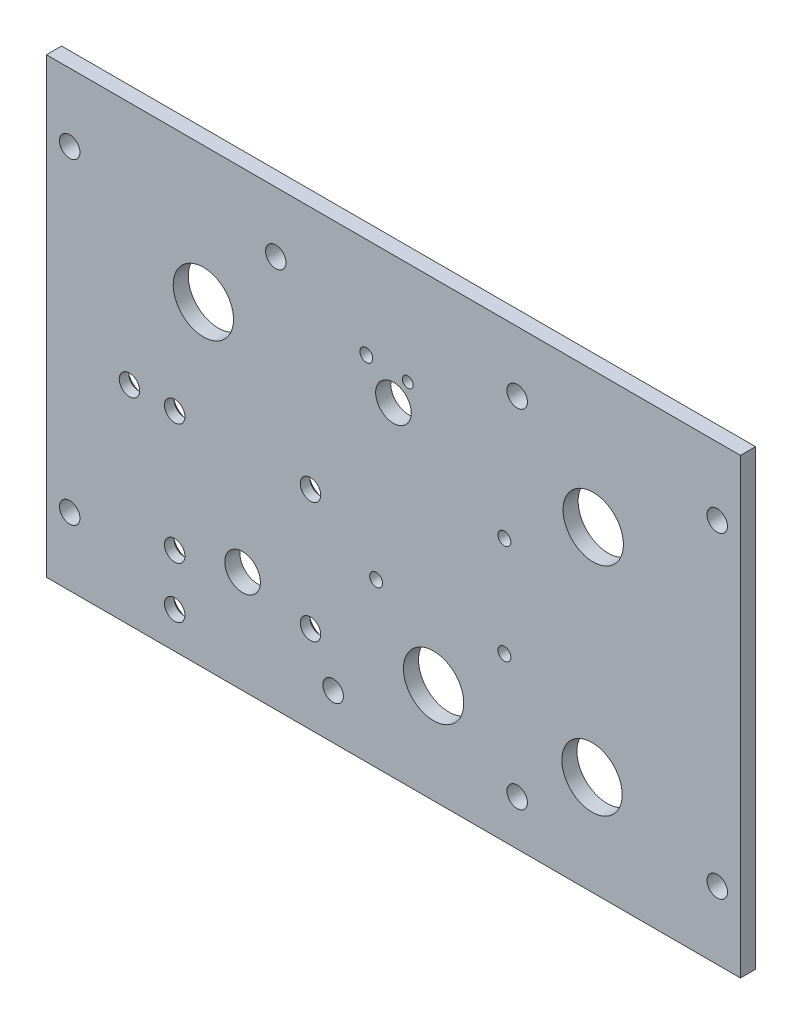
from build123d import *

# Parameters (mm, degrees)
SKETCH1_W                                         = 146.05
SKETCH1_H                                         = 95.25
BOSS_EXTRUDE1_DEPTH                               = 3.175
F_6_CLEARANCE_HOLE1_D                             = 4.3053
SKETCH5_R                                         = 6.35
SKETCH5_R_2                                       = 3.75
CUT_EXTRUDE1_DEPTH                                = 175.524869431
CSK_FOR_6_FLAT_HEAD_MACHINE_SCREW_100_D           = 4.3053
CSK_FOR_6_FLAT_HEAD_MACHINE_SCREW_100_CSINK_D     = 7.0866
CSK_FOR_6_FLAT_HEAD_MACHINE_SCREW_100_CSINK_ANGLE = 100
SKETCH8_R                                         = 1.134488875
CUT_EXTRUDE2_DEPTH                                = 175.39393804
CSK_FOR_2_FLAT_HEAD_MACHINE_SCREW_100_D           = 2.7051
CSK_FOR_2_FLAT_HEAD_MACHINE_SCREW_100_CSINK_D     = 4.3688
CSK_FOR_2_FLAT_HEAD_MACHINE_SCREW_100_CSINK_ANGLE = 100


with BuildPart() as part:
    # Sketch1 → Boss-Extrude1 (new body)
    with BuildSketch(Plane.XY):
        with Locations((-73.025, 47.625)):
            Rectangle(SKETCH1_W, SKETCH1_H)
    extrude(amount=-BOSS_EXTRUDE1_DEPTH)

    # #6 Clearance Hole1 (through all)
    with Locations(Plane(origin=(0, 0, -3.175), x_dir=(-1, 0, 0), z_dir=(0, 0, -1))):
        with Locations((4.8895, 80.9625), (141.1605, 80.9625), (141.1605, 14.2875), (4.8895, 14.2875), (46.99, 9.525), (85.725, 9.525), (97.79, 82.55), (46.99, 82.55)):
            Hole(F_6_CLEARANCE_HOLE1_D / 2)

    # Sketch5 → Cut-Extrude1 (cut, through all)
    with BuildSketch(Plane(origin=(0, 0, -7.4676), x_dir=(-1, 0, 0), z_dir=(0, 0, -1))):
        with Locations((30.988, 66.675)):
            Circle(SKETCH5_R)
        with Locations((113.03, 66.675)):
            Circle(SKETCH5_R)
        with Locations((64.5795, 20.955)):
            Circle(SKETCH5_R)
        with Locations((31.242, 20.955)):
            Circle(SKETCH5_R)
        with Locations((73.025, 68.326)):
            Circle(SKETCH5_R_2)
        with Locations((104.775, 21.59)):
            Circle(SKETCH5_R_2)
    extrude(amount=-CUT_EXTRUDE1_DEPTH, mode=Mode.SUBTRACT)

    # CSK for #6 Flat Head Machine Screw (100)1 (through all)
    with Locations(Plane(origin=(0, 0, -3.175), x_dir=(-1, 0, 0), z_dir=(0, 0, -1))):
        with Locations((90.4875, 43.815), (90.4875, 18.415), (119.0625, 7.636172046), (119.0625, 18.415), (119.0625, 43.815), (128.5875, 43.815)):
            CounterSinkHole(CSK_FOR_6_FLAT_HEAD_MACHINE_SCREW_100_D / 2, CSK_FOR_6_FLAT_HEAD_MACHINE_SCREW_100_CSINK_D / 2, counter_sink_angle=CSK_FOR_6_FLAT_HEAD_MACHINE_SCREW_100_CSINK_ANGLE)

    # Sketch8 → Cut-Extrude2 (cut, through all)
    with BuildSketch(Plane.XY):
        with Locations((-70.012401844, 73.606641948)):
            Circle(SKETCH8_R)
    extrude(amount=-CUT_EXTRUDE2_DEPTH, mode=Mode.SUBTRACT)

    # CSK for #2 Flat Head Machine Screw (100)1 (through all)
    with Locations(Plane(origin=(0, 0, -3.175), x_dir=(-1, 0, 0), z_dir=(0, 0, -1))):
        with Locations((49.68, 55.2646), (49.68, 34.2646), (76.68, 34.2646), (78.74, 74.171893855)):
            CounterSinkHole(CSK_FOR_2_FLAT_HEAD_MACHINE_SCREW_100_D / 2, CSK_FOR_2_FLAT_HEAD_MACHINE_SCREW_100_CSINK_D / 2, counter_sink_angle=CSK_FOR_2_FLAT_HEAD_MACHINE_SCREW_100_CSINK_ANGLE)


solid = part.part
